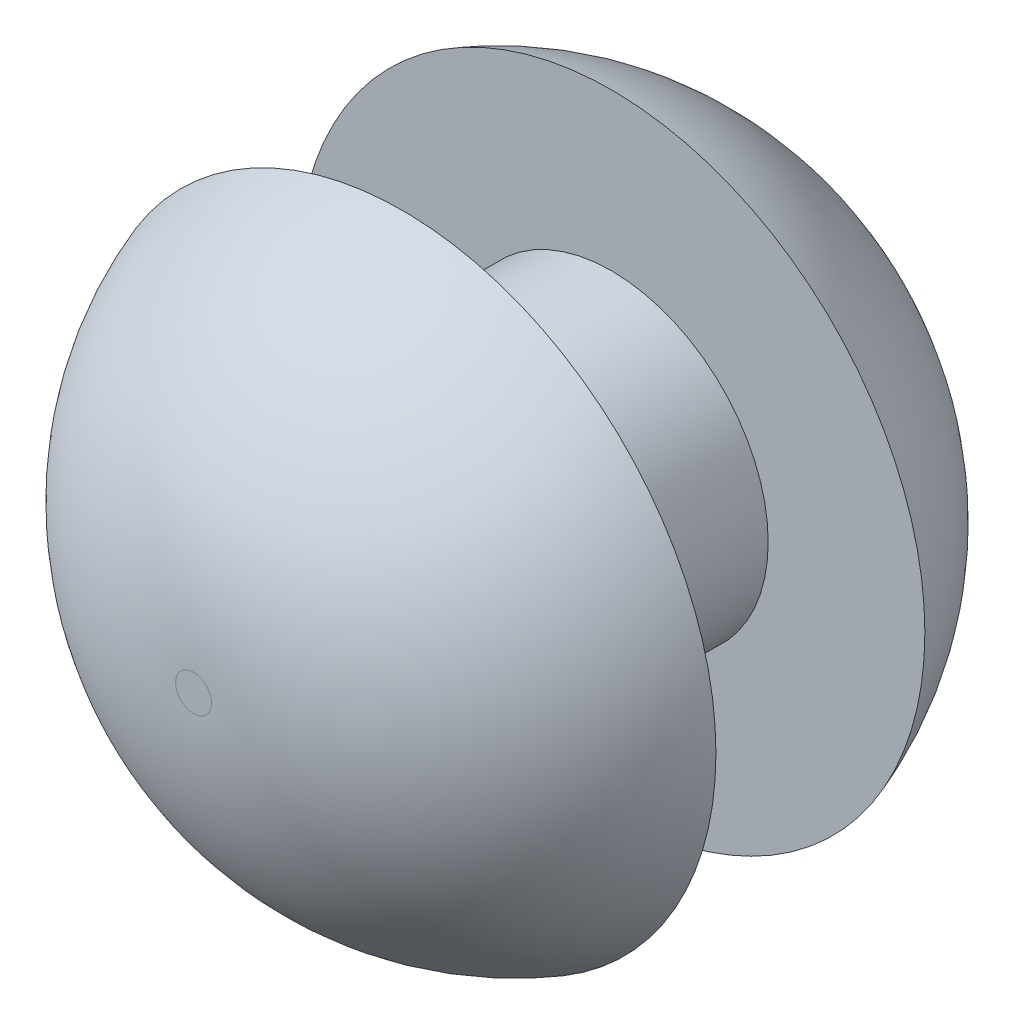
from build123d import *

# Parameters (mm, degrees)
ESBO_O1_R                = 0.15
RESSALTO_EXTRUS_O1_DEPTH = 0.1
ESBO_O2_R                = 0.3
RESSALTO_EXTRUS_O2_DEPTH = 0.2
FILETE1_R                = 0.3


with BuildPart() as part:
    # Esboço1 → Ressalto-extrusão1 (new, symmetric)
    with BuildSketch(Plane.XY):
        Circle(ESBO_O1_R)
    extrude(amount=RESSALTO_EXTRUS_O1_DEPTH, both=True)

    # Esboço2 → Ressalto-extrusão2 (add)
    with BuildSketch(Plane.XY.offset(0.1)):
        Circle(ESBO_O2_R)
    extrude(amount=RESSALTO_EXTRUS_O2_DEPTH)

    # Filete1
    # the kernel refuses this fillet: 0.3 mm, written as the material it takes off along each edge
    with BuildSketch(Plane(origin=(0, 0, 0.3), x_dir=(1, 0, 0), z_dir=(0, -1, 0))) as filete1_piece_1:
        with BuildLine():
            CenterArc((0.017157288, -0.3), FILETE1_R, 19.471220634, 70.528779366)
            Line((0.017157288, 0), (0.017157288, 0.006))
            Line((0.017157288, 0.006), (0.3, 0.006))
            Line((0.3, 0.006), (0.306, 0))
            ThreePointArc((0.306, 0), (0.306, -0.1), (0.305656854, -0.198))
            Line((0.305656854, -0.198), (0.3, -0.2))
        make_face()
    revolve(axis=Axis((0, 0, 0.3), (0, 0, 1)), mode=Mode.SUBTRACT)

    # Espelhar2: part across plane


with BuildPart() as part_1:
    add(part.part)
    add(part.part.mirror(Plane.XY))


solid = part_1.part
